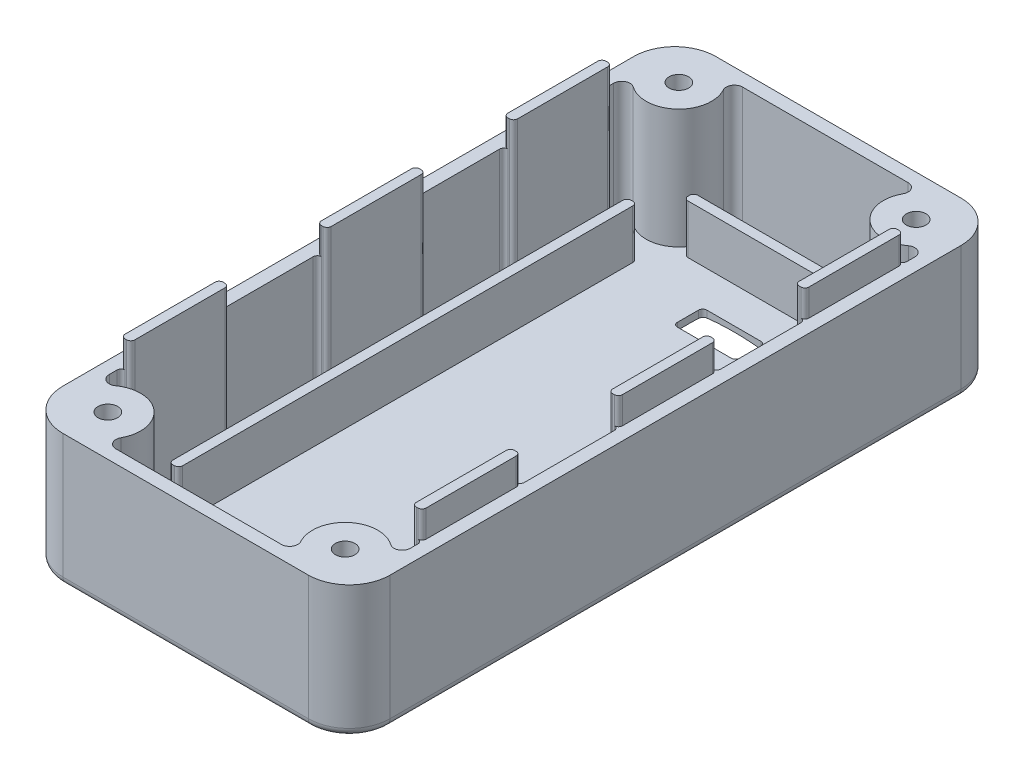
from build123d import *

# Parameters (mm, degrees)
BASE_SKETCH_W                    = 40
BASE_SKETCH_H                    = 79.79
BASE_DEPTH                       = 16.2
CORNER_ROUNDS_R5_R               = 5
SHELL_T                          = -1.6
SKETCH2_R                        = 4
SCREW_BOSSES_DEPTH               = 16.2
SKETCH3_W                        = 1.2
SKETCH3_H                        = 12
ALIGNMENT_TABS_DEPTH             = 19.5
BOTTOM_EDGE_ROUND_R1_R           = 1
SKETCH4_R                        = 1.2
M2_CLEARANCE_HOLES_DEPTH         = 92.360243542
SKETCH5_R                        = 2.2
M2_COUNTERBORES_DEPTH            = 12.2
SLIDE_SWITCH_CUTOUT_SKETCH_W     = 7.6
SLIDE_SWITCH_CUTOUT_SKETCH_H     = 3.6
SLIDE_SWITCH_CUTOUT_DEPTH        = 2
F_2XAAA_GUIDE_RAILS_SKETCH_W     = 1.2
F_2XAAA_GUIDE_RAILS_SKETCH_H     = 56
F_2XAAA_GUIDE_RAILS_DEPTH        = 7.6
F_2XAAA_END_RAILS_SKETCH_W       = 21
F_2XAAA_END_RAILS_SKETCH_H       = 1.2
F_2XAAA_END_RAILS_DEPTH          = 7.6
RAIL_BUTTRESS_CHAMFERS_3X45_SIZE = 3
LUG_JUNCTION_FILLETS_R1_R        = 1
CHAMFER2_SIZE                    = 1
FILLET2_R                        = 0.5
TAB_TOP_CORNER_FILLETS_R0_5_R    = 0.5


# Some blends are built 0.0001 mm under size
with BuildPart() as part:
    # Base Sketch → Base (new body)
    with BuildSketch(Plane(origin=(0, 0, 0), x_dir=(1, 0, 0), z_dir=(0, 1, 0))):
        with Locations((20, 39.895)):
            Rectangle(BASE_SKETCH_W, BASE_SKETCH_H)
    extrude(amount=BASE_DEPTH)

    # Corner Rounds R5
    corner_rounds_r5_edges = [part.edges().sort_by_distance(p)[0] for p in [
        (0, 8.1, -79.79),
        (40, 8.1, -79.79),
        (40, 8.1, 0),
        (0, 8.1, 0),
    ]]
    fillet(corner_rounds_r5_edges, radius=CORNER_ROUNDS_R5_R)

    # Shell
    shell_openings = [part.faces().sort_by_distance(p)[0] for p in [
        (20, 16.2, -39.895),
    ]]
    offset(amount=SHELL_T, openings=shell_openings, kind=Kind.INTERSECTION)

    # Sketch2 → Screw Bosses (add)
    with BuildSketch(Plane(origin=(0, 0, 0), x_dir=(1, 0, 0), z_dir=(0, 1, 0))):
        with Locations((5.5, 5)):
            Circle(SKETCH2_R)
        with Locations((34.5, 5)):
            Circle(SKETCH2_R)
        with Locations((5.5, 74.79)):
            Circle(SKETCH2_R)
        with Locations((34.5, 74.79)):
            Circle(SKETCH2_R)
    extrude(amount=SCREW_BOSSES_DEPTH)

    # Sketch3 → Alignment Tabs (add)
    with BuildSketch(Plane(origin=(0, 0, 0), x_dir=(1, 0, 0), z_dir=(0, 1, 0))):
        with Locations((2.2, 16.5)):
            Rectangle(SKETCH3_W, SKETCH3_H)
        with Locations((2.2, 40.5)):
            Rectangle(SKETCH3_W, SKETCH3_H)
        with Locations((2.2, 63.29)):
            Rectangle(SKETCH3_W, SKETCH3_H)
        with Locations((37.8, 16.5)):
            Rectangle(SKETCH3_W, SKETCH3_H)
        with Locations((37.8, 40.5)):
            Rectangle(SKETCH3_W, SKETCH3_H)
        with Locations((37.8, 63.29)):
            Rectangle(SKETCH3_W, SKETCH3_H)
    extrude(amount=ALIGNMENT_TABS_DEPTH)

    # Bottom Edge Round R1
    bottom_edge_round_r1_edges = [part.edges().sort_by_distance(p)[0] for p in [
        (0, 0, -39.895),
        (20, 0, -79.79),
        (40, 0, -39.895),
        (20, 0, 0),
        (1.464466094, 0, -1.464466094),
        (38.535533906, 0, -1.464466094),
        (38.535533906, 0, -78.325533906),
        (1.464466094, 0, -78.325533906),
    ]]
    fillet(bottom_edge_round_r1_edges, radius=BOTTOM_EDGE_ROUND_R1_R)

    # Sketch4 → M2 Clearance Holes (cut, through all)
    with BuildSketch(Plane(origin=(0, 0, 0), x_dir=(1, 0, 0), z_dir=(0, 1, 0))):
        with Locations(Location((5.5, 5, 0), (0, 0, 90))):
            Circle(SKETCH4_R)
        with Locations(Location((34.5, 5, 0), (0, 0, 90))):
            Circle(SKETCH4_R)
        with Locations(Location((5.5, 74.79, 0), (0, 0, 90))):
            Circle(SKETCH4_R)
        with Locations(Location((34.5, 74.79, 0), (0, 0, 90))):
            Circle(SKETCH4_R)
    extrude(amount=M2_CLEARANCE_HOLES_DEPTH, mode=Mode.SUBTRACT)

    # Sketch5 → M2 Counterbores (cut)
    with BuildSketch(Plane(origin=(0, 0, 0), x_dir=(1, 0, 0), z_dir=(0, 1, 0))):
        with Locations(Location((5.5, 5, 0), (0, 0, 270))):
            Circle(SKETCH5_R)
        with Locations(Location((34.5, 5, 0), (0, 0, 270))):
            Circle(SKETCH5_R)
        with Locations(Location((5.5, 74.79, 0), (0, 0, 270))):
            Circle(SKETCH5_R)
        with Locations(Location((34.5, 74.79, 0), (0, 0, 270))):
            Circle(SKETCH5_R)
    extrude(amount=M2_COUNTERBORES_DEPTH, mode=Mode.SUBTRACT)

    # Slide Switch Cutout Sketch → Slide Switch Cutout (cut)
    with BuildSketch(Plane(origin=(0, 0, 0), x_dir=(1, 0, 0), z_dir=(0, 1, 0))):
        with Locations((20, 65.2)):
            Rectangle(SLIDE_SWITCH_CUTOUT_SKETCH_W, SLIDE_SWITCH_CUTOUT_SKETCH_H)
    extrude(amount=SLIDE_SWITCH_CUTOUT_DEPTH, mode=Mode.SUBTRACT)

    # 2xAAA Guide Rails Sketch → 2xAAA Guide Rails (add)
    with BuildSketch(Plane(origin=(0, 0, 0), x_dir=(1, 0, 0), z_dir=(0, 1, 0))):
        with Locations((33.45, 40)):
            Rectangle(F_2XAAA_GUIDE_RAILS_SKETCH_W, F_2XAAA_GUIDE_RAILS_SKETCH_H)
        with Locations((6.55, 40)):
            Rectangle(F_2XAAA_GUIDE_RAILS_SKETCH_W, F_2XAAA_GUIDE_RAILS_SKETCH_H)
    extrude(amount=F_2XAAA_GUIDE_RAILS_DEPTH)

    # 2xAAA End Rails Sketch → 2xAAA End Rails (add)
    with BuildSketch(Plane(origin=(0, 0, 0), x_dir=(1, 0, 0), z_dir=(0, 1, 0))):
        with Locations((20, 7.8)):
            Rectangle(F_2XAAA_END_RAILS_SKETCH_W, F_2XAAA_END_RAILS_SKETCH_H)
        with Locations((20, 72)):
            Rectangle(F_2XAAA_END_RAILS_SKETCH_W, F_2XAAA_END_RAILS_SKETCH_H)
    extrude(amount=F_2XAAA_END_RAILS_DEPTH)

    # Rail Buttress Chamfers 3x45
    # the kernel refuses this chamfer: 3 mm, written as the material it adds along each edge
    with BuildSketch(Plane(origin=(34.05, 1.6, -68), x_dir=(0.9996219169112968, -0.027495876610586334, 0), z_dir=(0, 0, 1)), Plane(origin=(5.95, 1.6, -12), x_dir=(-0.9996219169112968, -0.027495876610586348, 0), z_dir=(0, 0, -1))) as rail_buttress_chamfers_3x45_piece_1:
        Polygon((RAIL_BUTTRESS_CHAMFERS_3X45_SIZE * 0.999621916911, RAIL_BUTTRESS_CHAMFERS_3X45_SIZE * 0.0274958766106), (-RAIL_BUTTRESS_CHAMFERS_3X45_SIZE * 0.0274958766106, RAIL_BUTTRESS_CHAMFERS_3X45_SIZE * 0.999621916911), (0, 0), align=None)
    extrude(amount=56)
    with BuildSketch(Plane(origin=(30.5, 1.6, -7.2), x_dir=(0, -0.027495876610586358, 0.9996219169112968), z_dir=(-1, 0, 0)), Plane(origin=(9.5, 1.6, -72.6), x_dir=(0, -0.027495876610586334, -0.9996219169112968), z_dir=(1, 0, 0))) as rail_buttress_chamfers_3x45_piece_2:
        Polygon((RAIL_BUTTRESS_CHAMFERS_3X45_SIZE * 0.999621916911, RAIL_BUTTRESS_CHAMFERS_3X45_SIZE * 0.0274958766106), (-RAIL_BUTTRESS_CHAMFERS_3X45_SIZE * 0.0274958766106, RAIL_BUTTRESS_CHAMFERS_3X45_SIZE * 0.999621916911), (0, 0), align=None)
    extrude(amount=21)

    # Lug Junction Fillets R1
    lug_junction_fillets_r1_edges = [part.edges().sort_by_distance(p)[0] for p in [
        (32.392869249, 8.9, -1.6),
        (38.4, 8.9, -5.888819442),
        (1.6, 8.9, -73.901180558),
        (7.607130751, 8.9, -78.19),
        (38.4, 8.9, -73.901180558),
        (32.392869249, 8.9, -78.19),
        (1.6, 8.9, -5.888819442),
        (7.607130751, 8.9, -1.6),
    ]]
    fillet(lug_junction_fillets_r1_edges, radius=LUG_JUNCTION_FILLETS_R1_R)

    # Switch Dish Sketch → Switch Finger Dish D15x1 (revolve, cut)
    with BuildSketch(Plane(origin=(20, 0, 0), x_dir=(0, 0, -1), z_dir=(1, 0, 0))):
        with BuildLine():
            Line((72.7, 0), (72.7, -0.5))
            Line((72.7, -0.5), (65.2, -0.5))
            Line((65.2, -0.5), (65.2, 1))
            ThreePointArc((65.2, 1), (68.983186488, 0.748898657), (72.7, 0))
        make_face()
    revolve(axis=Axis((20, -1, -65.2), (0, 1, 0)), mode=Mode.SUBTRACT)

    # Chamfer2
    chamfer2_edges = [part.edges().sort_by_distance(p)[0] for p in [
        (34.5, 12.2, -7.2),
        (34.5, 12.2, -76.99),
        (5.5, 12.2, -7.2),
    ]]
    chamfer(chamfer2_edges, length=CHAMFER2_SIZE - 0.0001)  # a hair under: the kernel refuses the full size

    # Fillet2
    fillet2_edges = [part.edges().sort_by_distance(p)[0] for p in [
        (1.6, 8.9, -46.5),
        (1.6, 8.9, -34.5),
        (2.8, 10.55, -34.5),
        (2.8, 10.55, -46.5),
        (1.6, 8.9, -69.29),
        (1.6, 8.9, -57.29),
        (2.8, 10.55, -57.29),
        (2.8, 10.55, -69.29),
        (37.2, 10.55, -22.5),
        (37.2, 10.55, -10.5),
        (38.4, 8.9, -10.5),
        (38.4, 8.9, -22.5),
        (37.2, 10.55, -46.5),
        (37.2, 10.55, -34.5),
        (38.4, 8.9, -34.5),
        (38.4, 8.9, -46.5),
        (37.2, 10.55, -69.29),
        (37.2, 10.55, -57.29),
        (38.4, 8.9, -57.29),
        (38.4, 8.9, -69.29),
        (1.6, 8.9, -22.5),
        (1.6, 8.9, -10.5),
        (2.8, 10.55, -10.5),
        (2.8, 10.55, -22.5),
        (16.2, 1.144747481, -67),
        (16.2, 1.144747481, -63.4),
        (23.8, 1.144747481, -63.4),
        (23.8, 1.144747481, -67),
        (32.85, 4.6, -68),
        (32.85, 4.6, -12),
        (34.05, 6.1, -12),
        (34.05, 6.1, -68),
        (5.95, 6.1, -68),
        (5.95, 6.1, -12),
        (7.15, 4.6, -12),
        (7.15, 4.6, -68),
        (9.5, 4.6, -8.4),
        (9.5, 6.1, -7.2),
        (30.5, 6.1, -7.2),
        (30.5, 4.6, -8.4),
        (9.5, 6.1, -72.6),
        (9.5, 4.6, -71.4),
        (30.5, 4.6, -71.4),
        (30.5, 6.1, -72.6),
    ]]
    fillet(fillet2_edges, radius=FILLET2_R)

    # Tab Top Corner Fillets R0.5
    tab_top_corner_fillets_r0_5_edges = [part.edges().sort_by_distance(p)[0] for p in [
        (38.4, 17.85, -57.29),
        (38.4, 17.85, -69.29),
        (38.4, 17.85, -34.5),
        (38.4, 17.85, -46.5),
        (38.4, 17.85, -10.5),
        (38.4, 17.85, -22.5),
        (1.6, 17.85, -57.29),
        (1.6, 17.85, -69.29),
        (1.6, 17.85, -34.5),
        (1.6, 17.85, -46.5),
        (1.6, 17.85, -22.5),
        (1.6, 17.85, -10.5),
    ]]
    fillet(tab_top_corner_fillets_r0_5_edges, radius=TAB_TOP_CORNER_FILLETS_R0_5_R)


solid = part.part
